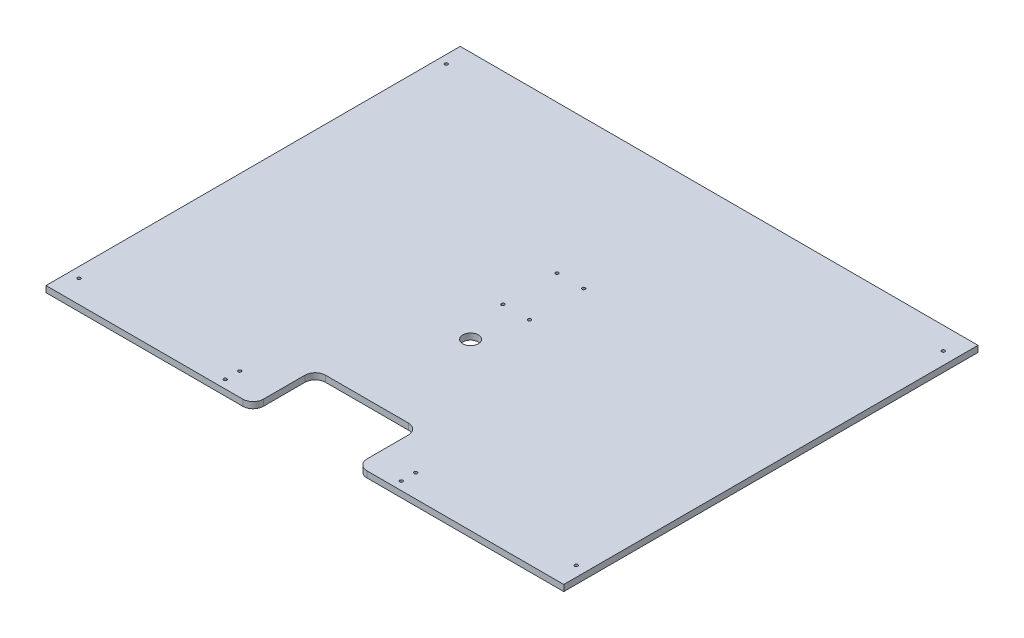
from build123d import *

# Parameters (mm, degrees)
SKETCH1_W           = 500
SKETCH1_H           = 400
SKETCH1_R           = 1.5
SKETCH1_R_2         = 1.525
BOSS_EXTRUDE1_DEPTH = 6
SKETCH2_R           = 1.5
CUT_EXTRUDE1_DEPTH  = 10
SKETCH3_R           = 7.5
SKETCH3_W           = 100
SKETCH3_H           = 60
CUT_EXTRUDE2_DEPTH  = 641.340534403
FILLET1_R           = 10


with BuildPart() as part:
    # Sketch1 → Boss-Extrude1 (new body)
    with BuildSketch(Plane(origin=(0, 0, 0), x_dir=(1, 0, 0), z_dir=(0, 1, 0))):
        with Locations((250, -200)):
            Rectangle(SKETCH1_W, SKETCH1_H)
        with Locations((490, -378)):
            Circle(SKETCH1_R, mode=Mode.SUBTRACT)
        with Locations((10, -378)):
            Circle(SKETCH1_R, mode=Mode.SUBTRACT)
        with Locations((236.4, -195.2)):
            Circle(SKETCH1_R, mode=Mode.SUBTRACT)
        with Locations((262.1, -195.2)):
            Circle(SKETCH1_R, mode=Mode.SUBTRACT)
        with Locations((262.1, -142.9)):
            Circle(SKETCH1_R, mode=Mode.SUBTRACT)
        with Locations((236.4, -142.9)):
            Circle(SKETCH1_R, mode=Mode.SUBTRACT)
        with Locations((8, -21.5)):
            Circle(SKETCH1_R, mode=Mode.SUBTRACT)
        with Locations((488, -21.5)):
            Circle(SKETCH1_R_2, mode=Mode.SUBTRACT)
    extrude(amount=BOSS_EXTRUDE1_DEPTH)

    # Sketch2 → Cut-Extrude1 (cut)
    with BuildSketch(Plane(origin=(0, 6, 0), x_dir=(1, 0, 0), z_dir=(0, 1, 0))):
        with Locations((165, -378)):
            Circle(SKETCH2_R)
        with Locations((165, -392)):
            Circle(SKETCH2_R)
        with Locations((335, -378)):
            Circle(SKETCH2_R)
        with Locations((335, -392)):
            Circle(SKETCH2_R)
    extrude(amount=-CUT_EXTRUDE1_DEPTH, mode=Mode.SUBTRACT)

    # Sketch3 → Cut-Extrude2 (cut, through all)
    with BuildSketch(Plane.XZ):
        with Locations((250, 240)):
            Circle(SKETCH3_R)
        with Locations((250, 370)):
            Rectangle(SKETCH3_W, SKETCH3_H)
    extrude(amount=-CUT_EXTRUDE2_DEPTH, mode=Mode.SUBTRACT)

    # Fillet1
    fillet1_edges = [part.edges().sort_by_distance(p)[0] for p in [
        (200, 3, 400),
        (300, 3, 400),
        (200, 3, 340),
        (300, 3, 340),
    ]]
    fillet(fillet1_edges, radius=FILLET1_R)


solid = part.part
